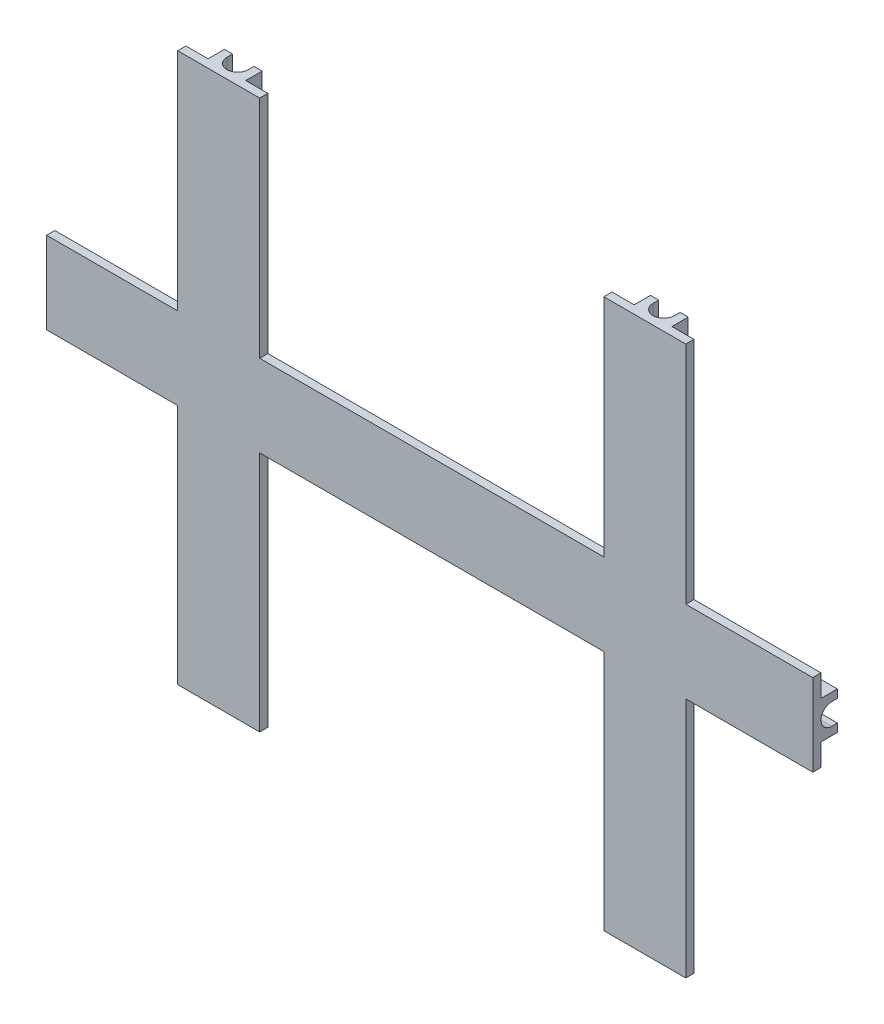
from build123d import *

# Parameters (mm, degrees)
AUFSATZ_LINEAR_AUSTRAGEN1_DEPTH = 1
SKIZZE2_W                       = 16
SKIZZE2_H                       = 10
SKIZZE2_W_2                     = 15.5
AUFSATZ_LINEAR_AUSTRAGEN2_DEPTH = 1
SKIZZE4_W                       = 93.5
SKIZZE4_H                       = 1
SKIZZE4_W_2                     = 1
SKIZZE4_H_2                     = 67
AUFSATZ_LINEAR_AUSTRAGEN5_DEPTH = 2
VERRUNDUNG1_R                   = 1.3
VERRUNDUNG2_R                   = 1.3
VERRUNDUNG3_R                   = 1.3
VERRUNDUNG4_R                   = 1.3
VERRUNDUNG5_R                   = 1.3
VERRUNDUNG6_R                   = 1.3
VERRUNDUNG7_R                   = 1.3
VERRUNDUNG8_R                   = 1.3
VERRUNDUNG9_R                   = 1.3
VERRUNDUNG10_R                  = 1.3
VERRUNDUNG11_R                  = 1.3
VERRUNDUNG12_R                  = 1.3
VERRUNDUNG13_R                  = 1.3


with BuildPart() as part:
    # Skizze1 → Aufsatz-Linear austragen1 (new body)
    with BuildSketch(Plane.XY):
        Polygon((-31, -15.187500578), (-31, 32.5), (-21, 32.5), (-21, 5), (21, 5), (21, 32.5), (31, 32.5), (31, -34.5), (21, -34.5), (21, -5), (-21, -5), (-21, -34.5), (-31, -34.5), align=None)
    extrude(amount=AUFSATZ_LINEAR_AUSTRAGEN1_DEPTH)

    # Skizze2 → Aufsatz-Linear austragen2 (add)
    with BuildSketch(Plane(origin=(0, 0, 0), x_dir=(-1, 0, 0), z_dir=(0, 0, -1))):
        with Locations((39, 0)):
            Rectangle(SKIZZE2_W, SKIZZE2_H)
        with Locations((-38.75, 0)):
            Rectangle(SKIZZE2_W_2, SKIZZE2_H)
    extrude(amount=-AUFSATZ_LINEAR_AUSTRAGEN2_DEPTH)

    # Skizze4 → Aufsatz-Linear austragen5 (add)
    with BuildSketch(Plane(origin=(0, 0, 0), x_dir=(-1, 0, 0), z_dir=(0, 0, -1))):
        with Locations((0.25, 1.8)):
            Rectangle(SKIZZE4_W, SKIZZE4_H)
        with Locations((0.25, -1.8)):
            Rectangle(SKIZZE4_W, SKIZZE4_H)
        with Locations((-27.8, -1)):
            Rectangle(SKIZZE4_W_2, SKIZZE4_H_2)
        with Locations((-24.2, -1)):
            Rectangle(SKIZZE4_W_2, SKIZZE4_H_2)
        with Locations((24.2, -1)):
            Rectangle(SKIZZE4_W_2, SKIZZE4_H_2)
        with Locations((27.8, -1)):
            Rectangle(SKIZZE4_W_2, SKIZZE4_H_2)
    extrude(amount=AUFSATZ_LINEAR_AUSTRAGEN5_DEPTH)

    # Verrundung1
    verrundung1_edges = [part.edges().sort_by_distance(p)[0] for p in [
        (24.7, 17.4, 0),
    ]]
    fillet(verrundung1_edges, radius=VERRUNDUNG1_R)

    # Verrundung2
    verrundung2_edges = [part.edges().sort_by_distance(p)[0] for p in [
        (27.3, 17.4, 0),
    ]]
    fillet(verrundung2_edges, radius=VERRUNDUNG2_R - 0.0001)  # a hair under: the kernel refuses the full size

    # Verrundung3
    verrundung3_edges = [part.edges().sort_by_distance(p)[0] for p in [
        (37.4, 1.3, 0),
        (26, 1.3, 0),
        (0, 1.3, 0),
        (-26, 1.3, 0),
        (-37.65, 1.3, 0),
    ]]
    fillet(verrundung3_edges, radius=VERRUNDUNG3_R)

    # Verrundung4
    verrundung4_edges = [part.edges().sort_by_distance(p)[0] for p in [
        (37.4, -1.3, 0),
        (26, -1.3, 0),
        (0, -1.3, 0),
        (-26, -1.3, 0),
        (-37.65, -1.3, 0),
    ]]
    fillet(verrundung4_edges, radius=VERRUNDUNG4_R - 0.0001)  # a hair under: the kernel refuses the full size

    # Verrundung5
    verrundung5_edges = [part.edges().sort_by_distance(p)[0] for p in [
        (24.7, 2.3, -1.65),
        (27.3, 2.3, -1.64995),
        (26.919268105, 2.3, -0.380731895),
        (25.080761184, 2.3, -0.380761184),
    ]]
    fillet(verrundung5_edges, radius=VERRUNDUNG5_R - 0.0001)  # a hair under: the kernel refuses the full size

    # Verrundung6
    verrundung6_edges = [part.edges().sort_by_distance(p)[0] for p in [
        (24.7, 1.3, -1.65),
        (24.7, -1.3, -1.64995),
        (28.3, 1.3, -1.65),
        (28.3, -1.3, -1.64995),
        (24.7, -0.919268105, -0.380731895),
        (24.7, 0.919238816, -0.380761184),
        (28.3, 0.919238816, -0.380761184),
        (28.3, -0.919268105, -0.380731895),
    ]]
    fillet(verrundung6_edges, radius=VERRUNDUNG6_R - 0.0001)  # a hair under: the kernel refuses the full size

    # Verrundung7
    verrundung7_edges = [part.edges().sort_by_distance(p)[0] for p in [
        (23.7, -1.3, -1.64995),
        (23.7, 1.3, -1.65),
        (27.3, -1.3, -1.64995),
        (27.3, 1.3, -1.65),
        (23.7, 0.919238816, -0.380761184),
        (23.7, -0.919268105, -0.380731895),
        (27.3, -0.919268105, -0.380731895),
        (27.3, 0.919238816, -0.380761184),
    ]]
    fillet(verrundung7_edges, radius=VERRUNDUNG7_R - 0.0001)  # a hair under: the kernel refuses the full size

    # Verrundung8
    verrundung8_edges = [part.edges().sort_by_distance(p)[0] for p in [
        (27.3, -18.4, 0),
        (24.7, -18.4, 0),
    ]]
    fillet(verrundung8_edges, radius=VERRUNDUNG8_R - 0.0001)  # a hair under: the kernel refuses the full size

    # Verrundung9
    verrundung9_edges = [part.edges().sort_by_distance(p)[0] for p in [
        (27.3, -2.3, -1.64995),
        (24.7, -2.3, -1.64995),
        (25.080731895, -2.3, -0.380731895),
        (26.919268105, -2.3, -0.380731895),
    ]]
    fillet(verrundung9_edges, radius=VERRUNDUNG9_R - 0.0001)  # a hair under: the kernel refuses the full size

    # Verrundung10
    verrundung10_edges = [part.edges().sort_by_distance(p)[0] for p in [
        (-24.7, -1.3, -1.64995),
        (-24.7, -0.919268105, -0.380731895),
        (-24.7, 1.3, -1.65),
        (-28.3, -1.3, -1.64995),
        (-28.3, 1.3, -1.65),
        (-24.7, 0.919238816, -0.380761184),
        (-24.7, -18.4, 0),
        (-24.7, 17.4, 0),
        (-28.3, -0.919268105, -0.380731895),
        (-28.3, 0.919238816, -0.380761184),
    ]]
    fillet(verrundung10_edges, radius=VERRUNDUNG10_R - 0.0001)  # a hair under: the kernel refuses the full size

    # Verrundung11
    verrundung11_edges = [part.edges().sort_by_distance(p)[0] for p in [
        (-23.7, 1.3, -1.65),
        (-23.7, -1.3, -1.64995),
        (-27.3, 1.3, -1.65),
        (-27.3, -1.3, -1.64995),
        (-27.3, -18.4, 0),
        (-23.7, -0.919268105, -0.380731895),
        (-23.7, 0.919238816, -0.380761184),
        (-27.3, -0.919268105, -0.380731895),
        (-27.3, 0.919238816, -0.380761184),
        (-27.3, 17.4, 0),
    ]]
    fillet(verrundung11_edges, radius=VERRUNDUNG11_R - 0.0001)  # a hair under: the kernel refuses the full size

    # Verrundung12
    verrundung12_edges = [part.edges().sort_by_distance(p)[0] for p in [
        (-24.7, -2.3, -1.64995),
        (-27.3, -2.3, -1.64995),
        (-25.080731895, -2.3, -0.380731895),
        (-26.919268105, -2.3, -0.380731895),
    ]]
    fillet(verrundung12_edges, radius=VERRUNDUNG12_R - 0.0001)  # a hair under: the kernel refuses the full size

    # Verrundung13
    verrundung13_edges = [part.edges().sort_by_distance(p)[0] for p in [
        (-27.3, 2.3, -1.64995),
        (-24.7, 2.3, -1.64995),
        (-25.080731895, 2.3, -0.380731895),
        (-26.919268105, 2.3, -0.380731895),
    ]]
    fillet(verrundung13_edges, radius=VERRUNDUNG13_R - 0.0001)  # a hair under: the kernel refuses the full size


solid = part.part
